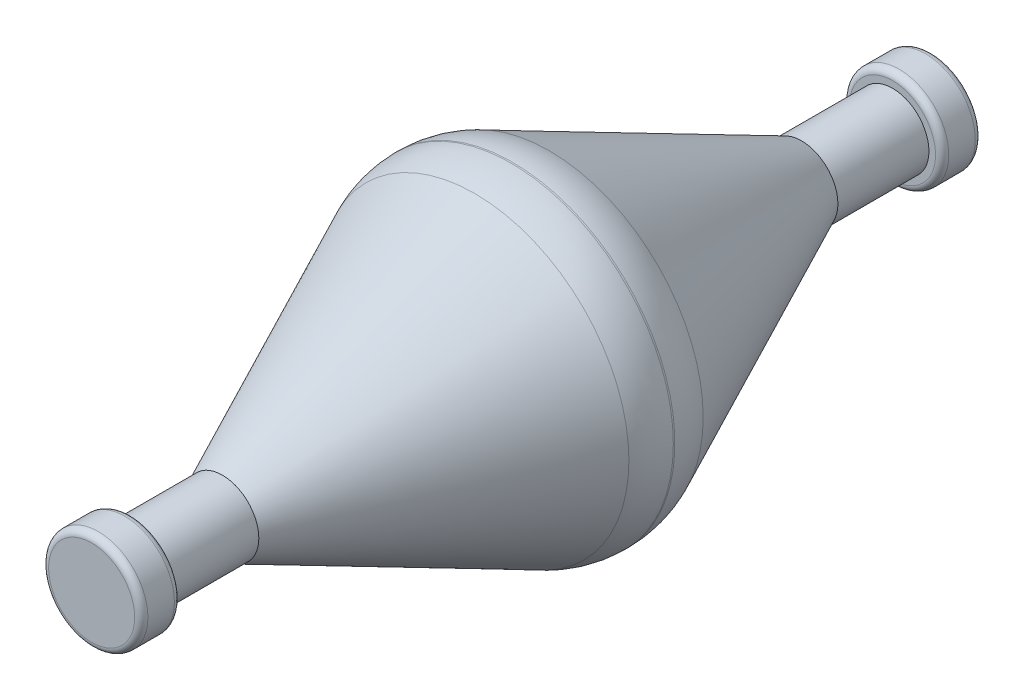
from build123d import *

# Parameters (mm, degrees)
ESQUISSE1_R             = 6.125
BOSS_EXTRU_1_DEPTH      = 22
BOSS_EXTRU_2_DEPTH      = 15.875
BOSS_EXTRU_2_DEPTH_BACK = 15.875
BOSS_EXTRU_2_START      = -11
ESQUISSE2_R             = 1.375
ESQUISSE3_R             = 1.875
BOSS_EXTRU_3_DEPTH      = 1.5
BOSS_EXTRU_4_START      = -1.5
ESQUISSE4_R             = 1.875
BOSS_EXTRU_4_DEPTH      = 1.5
CHANFREIN1_SIZE         = 10.25
CHANFREIN1_SIZE_2       = 4.779653496
CONG_1_R                = 3.25
CONG_2_R                = 0.25


with BuildPart() as part:
    # Esquisse1 → Boss.-Extru.1 (new body)
    with BuildSketch(Plane.XY):
        Circle(ESQUISSE1_R)
    extrude(amount=BOSS_EXTRU_1_DEPTH)

    # Esquisse2 → Boss.-Extru.2 (add, two sides: drawn at the far end of the back side and taken through both)
    with BuildSketch(Plane.XY.offset(22).offset(BOSS_EXTRU_2_START - BOSS_EXTRU_2_DEPTH_BACK)):
        Circle(ESQUISSE2_R)
    extrude(amount=BOSS_EXTRU_2_DEPTH + BOSS_EXTRU_2_DEPTH_BACK)

    # Esquisse3 → Boss.-Extru.3 (add)
    with BuildSketch(Plane(origin=(0, 0, -4.875), x_dir=(-1, 0, 0), z_dir=(0, 0, -1))):
        Circle(ESQUISSE3_R)
    extrude(amount=-BOSS_EXTRU_3_DEPTH)

    # Esquisse4 → Boss.-Extru.4 (add)
    with BuildSketch(Plane.XY.offset(26.875).offset(BOSS_EXTRU_4_START)):
        with Locations(Location((0, 0, 0), (0, 0, 180))):
            Circle(ESQUISSE4_R)
    extrude(amount=BOSS_EXTRU_4_DEPTH)

    # Chanfrein1
    # the kernel refuses this chamfer: 10.25, 4.779653496 mm, written as the material it takes off along each edge
    with BuildSketch(Plane(origin=(0, 0, 22), x_dir=(1, 0, 0), z_dir=(0, -1, 0))) as chanfrein1_piece_1_section:
        Polygon((6.125, -CHANFREIN1_SIZE), (6.125 - CHANFREIN1_SIZE_2, 0), (6.125, 0), align=None)
    chanfrein1_piece_1 = revolve(axis=Axis((0, 0, 22), (0, 0, 1)), mode=Mode.PRIVATE)
    chanfrein1_piece_1 = chanfrein1_piece_1 - Plane(origin=(0, 0, 16.69695502), x_dir=(1, 0, 0), z_dir=(0, 0, -1)) * Cylinder(1.375, 41, mode=Mode.PRIVATE)
    add(chanfrein1_piece_1, mode=Mode.SUBTRACT)
    with BuildSketch(Plane(origin=(0, 0, 0), x_dir=(1, 0, 0), z_dir=(0, -1, 0))) as chanfrein1_piece_2_section:
        Polygon((6.125, CHANFREIN1_SIZE), (6.125 - CHANFREIN1_SIZE_2, 0), (6.125, 0), align=None)
    chanfrein1_piece_2 = revolve(axis=Axis((0, 0, 0), (0, 0, 1)), mode=Mode.PRIVATE)
    chanfrein1_piece_2 = chanfrein1_piece_2 - Plane(origin=(0, 0, 5.30304498), x_dir=(1, 0, 0), z_dir=(0, 0, 1)) * Cylinder(1.375, 41, mode=Mode.PRIVATE)
    add(chanfrein1_piece_2, mode=Mode.SUBTRACT)

    # Congé1
    cong_1_edges = [part.edges().sort_by_distance(p)[0] for p in [
        (-6.125, 0, 11.75),
        (-6.125, 0, 10.25),
    ]]
    fillet(cong_1_edges, radius=CONG_1_R)

    # Congé2
    cong_2_edges = [part.edges().sort_by_distance(p)[0] for p in [
        (1.875, 0, -3.375),
        (1.875, 0, -4.875),
        (1.875, 0, 25.375),
        (1.875, 0, 26.875),
    ]]
    fillet(cong_2_edges, radius=CONG_2_R)


solid = part.part
